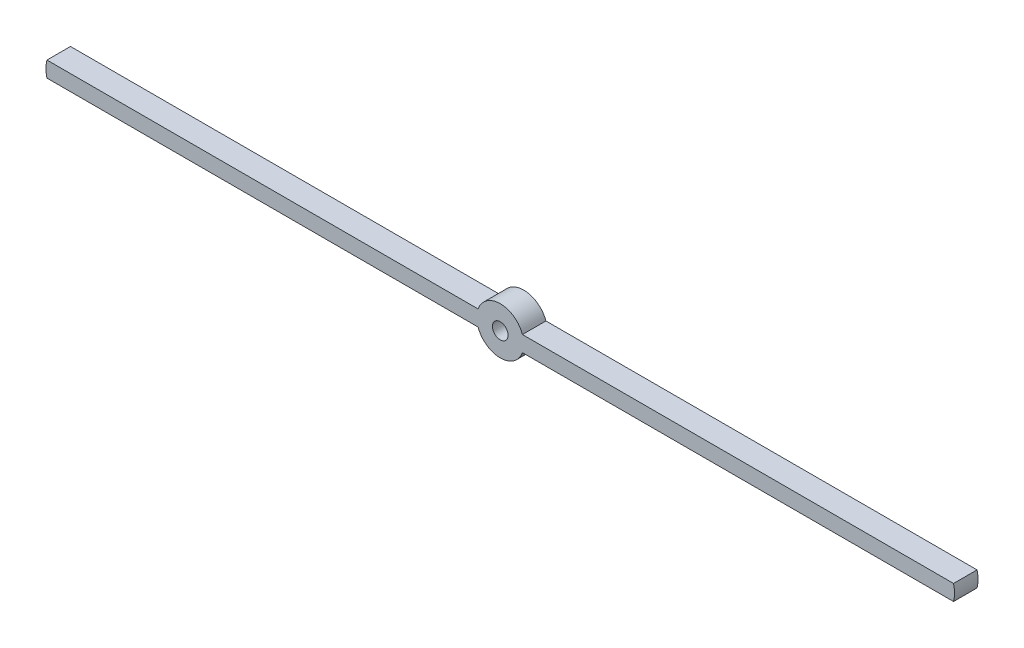
from build123d import *

# Parameters (mm, degrees)
ESQUISSE1_R        = 2
BOSS_EXTRU_1_DEPTH = 6


with BuildPart() as part:
    # Esquisse1 → Boss.-Extru.1 (new body)
    with BuildSketch(Plane.XY):
        with BuildLine():
            ThreePointArc((5.656854249, 2), (0, 6), (-5.656854249, 2))
            Line((-5.656854249, 2), (-115.656854249, 2))
            ThreePointArc((-115.656854249, 2), (-115.910887557, 0), (-115.656854249, -2))
            Line((-115.656854249, -2), (-5.656854249, -2))
            ThreePointArc((-5.656854249, -2), (0, -6), (5.656854249, -2))
            Line((5.656854249, -2), (115.656854249, -2))
            ThreePointArc((115.656854249, -2), (115.910887557, 0), (115.656854249, 2))
            Line((115.656854249, 2), (5.656854249, 2))
        make_face()
        Circle(ESQUISSE1_R, mode=Mode.SUBTRACT)
    extrude(amount=BOSS_EXTRU_1_DEPTH)


solid = part.part
